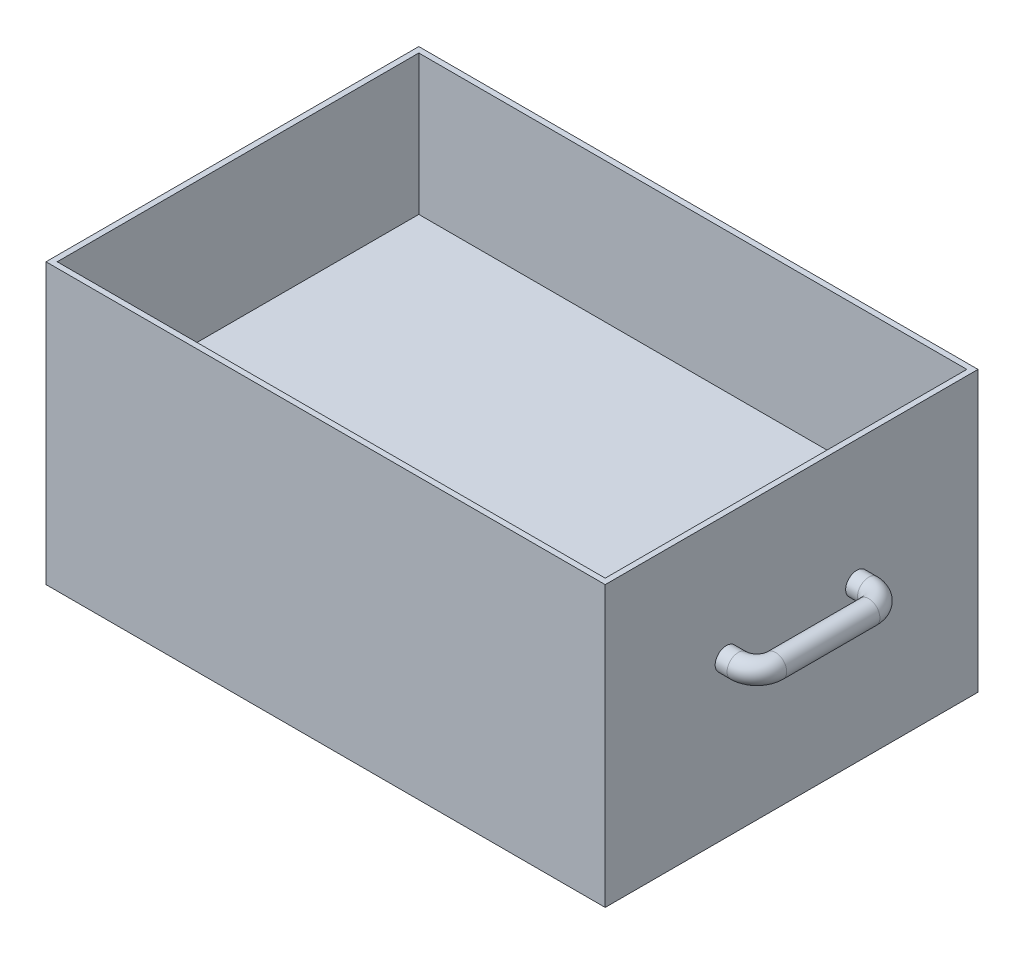
from build123d import *

# Parameters (mm, degrees)
SKETCH1_W                 = 300
SKETCH1_H                 = 200
BOSS_EXTRUDE1_DEPTH       = 150
SHELL1_T                  = -3
SHELL1_THICKNESS_2_FACE_W = 194
SHELL1_THICKNESS_2_FACE_H = 294
SHELL1_THICKNESS_2_DEPTH  = 72
SHELL2_START              = -133.820083682
SHELL2_OUTLINE_W          = 72
SHELL2_OUTLINE_H          = 194
SHELL2_DEPTH              = 294
SKETCH2_R                 = 6


# Read off the part's stored shape, not the designer's step: Shell2
with BuildPart() as part:
    # Sketch1 → Boss-Extrude1 (new body)
    with BuildSketch(Plane(origin=(0, 0, 0), x_dir=(1, 0, 0), z_dir=(0, 1, 0))):
        with Locations((13.179916318, 19.874476987)):
            Rectangle(SKETCH1_W, SKETCH1_H)
    extrude(amount=BOSS_EXTRUDE1_DEPTH)

    # Shell1
    shell1_openings = [part.faces().sort_by_distance(p)[0] for p in [
        (13.179916318, 150, -19.874476987),
    ]]
    offset(amount=SHELL1_T, openings=shell1_openings, kind=Kind.INTERSECTION)

    # Shell1 thickness 2 face (on inner face of the shell) → Shell1 thickness 2 (add)
    with BuildSketch(Plane(origin=(13.179916318, 3, -19.874476987), x_dir=(0, 0, -1), z_dir=(0, -1, 0))):
        Rectangle(SHELL1_THICKNESS_2_FACE_W, SHELL1_THICKNESS_2_FACE_H)
    extrude(amount=-SHELL1_THICKNESS_2_DEPTH)

    # Shell2 outline → Shell2 (cut)
    with BuildSketch(Plane.YZ.offset(SHELL2_START)):
        with Locations((36, -19.874476987)):
            Rectangle(SHELL2_OUTLINE_W, SHELL2_OUTLINE_H)
    extrude(amount=SHELL2_DEPTH, mode=Mode.SUBTRACT)

    # Sweep2: sweep along a path in Sketch4
    with BuildLine(Plane(origin=(0, 83.172395684, 0), x_dir=(1, 0, 0), z_dir=(0, 1, 0))) as sweep2_path:
        Line((163.179916318, -15.125523013), (169.565605174, -15.125523013))
        ThreePointArc((169.565605174, -15.125523013), (176.636672985, -12.196590824), (179.565605174, -5.125523013))
        Line((179.565605174, -5.125523013), (179.565605174, 44.874476987))
        ThreePointArc((179.565605174, 44.874476987), (176.636672985, 51.945544799), (169.565605174, 54.874476987))
        Line((169.565605174, 54.874476987), (163.179916318, 54.874476987))
    # Sketch2 → Sweep2 (sweep)
    with BuildSketch(Plane(origin=(163.179916318, 0, 0), x_dir=(0, 0, -1), z_dir=(1, 0, 0))):
        with Locations((-15.125523013, 83.172395684)):
            Circle(SKETCH2_R)
    sweep(path=sweep2_path.line)


solid = part.part
